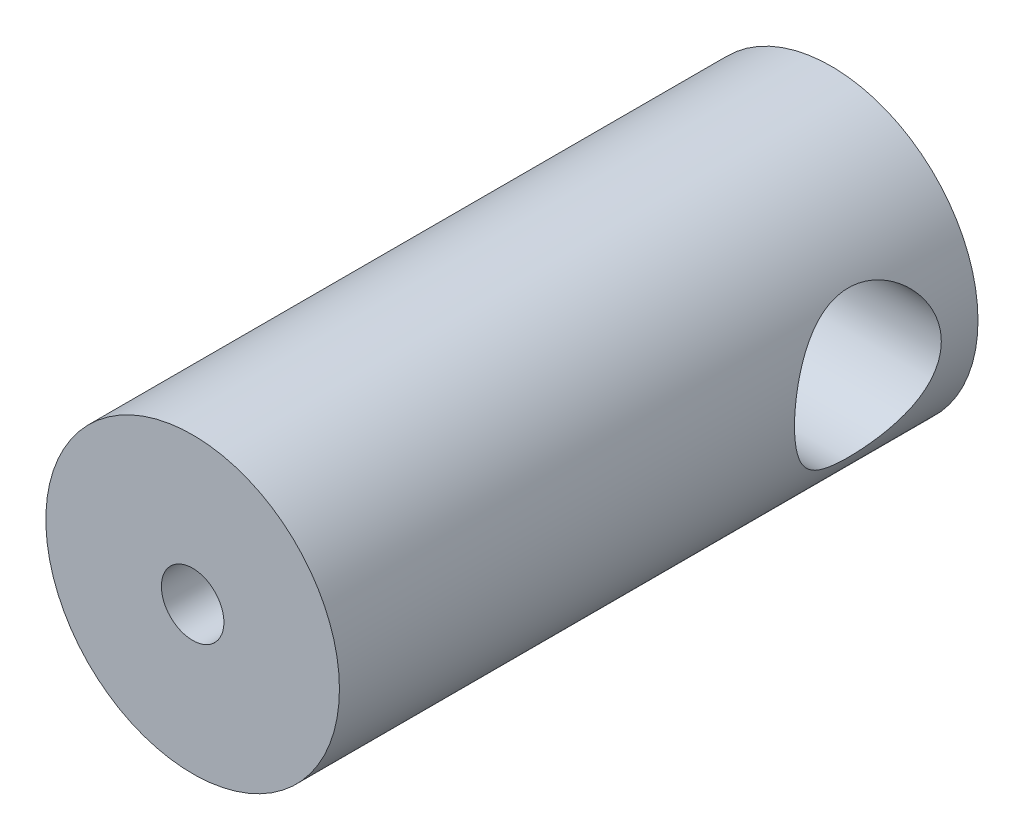
from build123d import *

# Parameters (mm, degrees)
SKETCH1_R                 = 6.35
BOSS_EXTRUDE1_DEPTH       = 27.6225
CUT_EXTRUDE2_DEPTH        = 30.045610791
CUT_EXTRUDE2_DEPTH_BACK   = 30.045610791
SKETCH3_R                 = 3.175
F_6_32_TAPPED_HOLE1_D     = 2.7051
F_6_32_TAPPED_HOLE1_DEPTH = 12.7
F_6_32_TAPPED_HOLE1_TIP   = 0.81269403


with BuildPart() as part:
    # Sketch1 → Boss-Extrude1 (new body)
    with BuildSketch(Plane.XY):
        Circle(SKETCH1_R)
    extrude(amount=BOSS_EXTRUDE1_DEPTH)

    # Sketch3 → Cut-Extrude2 (cut, two sides: drawn at the far end of the back side and taken through both)
    with BuildSketch(Plane(origin=(0, 0, 0), x_dir=(0, 0, -1), z_dir=(1, 0, 0)).offset(-CUT_EXTRUDE2_DEPTH_BACK)):
        with Locations((-4.7625, 0)):
            Circle(SKETCH3_R)
    extrude(amount=CUT_EXTRUDE2_DEPTH + CUT_EXTRUDE2_DEPTH_BACK, mode=Mode.SUBTRACT)

    # #6-32 Tapped Hole1
    with Locations(Plane.XY.offset(27.6225)):
        with Locations((0, 0)):
            Hole(F_6_32_TAPPED_HOLE1_D / 2, depth=F_6_32_TAPPED_HOLE1_DEPTH)
            with Locations((0, 0, -(F_6_32_TAPPED_HOLE1_DEPTH + F_6_32_TAPPED_HOLE1_TIP / 2))):  # 118° drill point
                Cone(0, F_6_32_TAPPED_HOLE1_D / 2, F_6_32_TAPPED_HOLE1_TIP, mode=Mode.SUBTRACT)


solid = part.part
